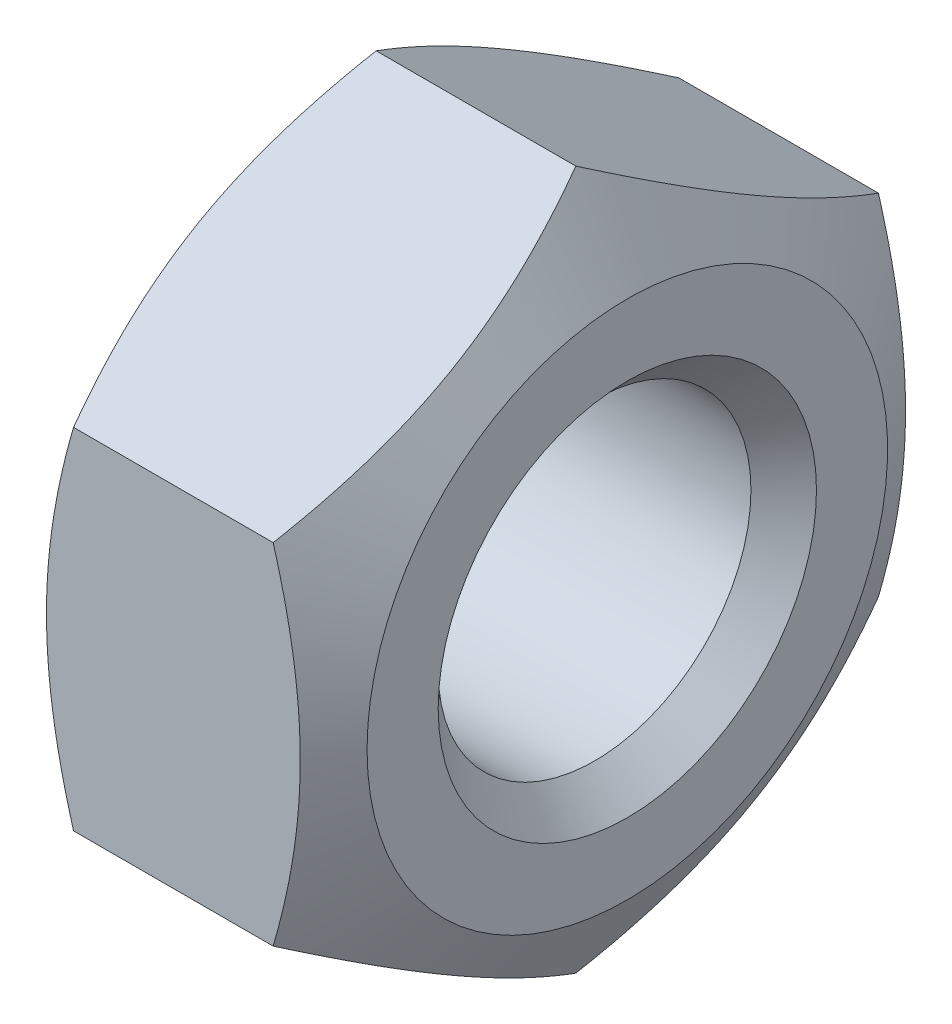
from build123d import *

# Parameters (mm, degrees)
BOSS_EXTRUDE1_DEPTH      = 2
BOSS_EXTRUDE1_DEPTH_BACK = 2


with BuildPart() as part:
    # Sketch1 → Boss-Extrude1 (new, two sides: drawn at the far end of the back side and taken through both)
    with BuildSketch(Plane(origin=(0, 0, 0), x_dir=(0, 0, -1), z_dir=(1, 0, 0)).offset(-BOSS_EXTRUDE1_DEPTH_BACK)):
        Polygon((-4, -2.309401077), (0, -4.618802154), (4, -2.309401077), (4, 2.309401077), (0, 4.618802154), (-4, 2.309401077), align=None)
    extrude(amount=BOSS_EXTRUDE1_DEPTH + BOSS_EXTRUDE1_DEPTH_BACK)

    # Sketch2 → Cut-Revolve1 (revolve, cut)
    with BuildSketch(Plane.XY):
        Polygon((-2, 0), (-2, 2.5), (-1.567, 2.067), (1.567, 2.067), (2, 2.5), (2, 0), align=None)
    revolve(axis=Axis((2, 0, 0), (-1, 0, 0)), mode=Mode.SUBTRACT)

    # Sketch3 → Cut-Revolve2 (revolve, cut)
    with BuildSketch(Plane.XY):
        Polygon((-7, 1), (-2, 1), (-2, 3.44), (0, 6.904101615), (2, 3.44), (2, 1), (7, 1), (7, 8.44), (-7, 8.44), align=None)
    revolve(axis=Axis((50, 0, 0), (-1, 0, 0)), mode=Mode.SUBTRACT)


solid = part.part
